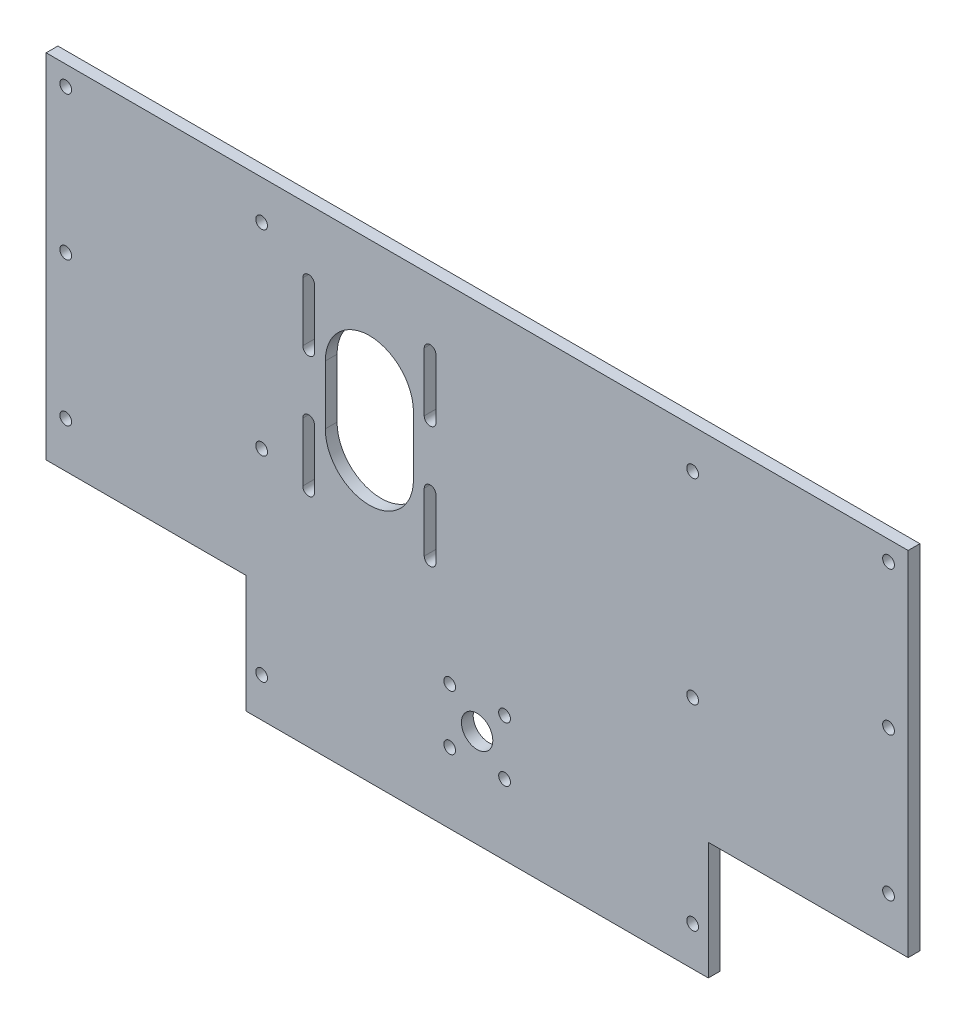
from build123d import *

# Parameters (mm, degrees)
ESQUISSE1_R             = 1.5
BOSS_EXTRU_1_DEPTH      = 3
ESQUISSE3_R             = 4
ESQUISSE3_R_2           = 1.5
ENL_V_MAT_EXTRU_3_DEPTH = 10


with BuildPart() as part:
    # Esquisse1 → Boss.-Extru.1 (new body)
    with BuildSketch(Plane.XY):
        Polygon((110, 65), (60, 65), (-60, 65), (-110, 65), (-110, -25), (-60, -25), (-59, -25), (-59, -55), (-50, -55), (50, -55), (59, -55), (59, -25), (60, -25), (110, -25), align=None)
        with Locations((-55, -45)):
            Circle(ESQUISSE1_R, mode=Mode.SUBTRACT)
        with Locations((-105, -13.333333333)):
            Circle(ESQUISSE1_R, mode=Mode.SUBTRACT)
        with Locations((-55, 5)):
            Circle(ESQUISSE1_R, mode=Mode.SUBTRACT)
        with Locations((55, -45)):
            Circle(ESQUISSE1_R, mode=Mode.SUBTRACT)
        with Locations((105, -13.333333333)):
            Circle(ESQUISSE1_R, mode=Mode.SUBTRACT)
        with Locations((55, 5)):
            Circle(ESQUISSE1_R, mode=Mode.SUBTRACT)
        with Locations((-105, 23.333333333)):
            Circle(ESQUISSE1_R, mode=Mode.SUBTRACT)
        with BuildLine():
            ThreePointArc((-41.5, 2), (-43, 0.5), (-44.5, 2))
            Line((-44.5, 2), (-44.5, 17))
            ThreePointArc((-44.5, 17), (-43, 18.5), (-41.5, 17))
            Line((-41.5, 17), (-41.5, 2))
        make_face(mode=Mode.SUBTRACT)
        with BuildLine():
            Line((-10.5, 17), (-10.5, 2))
            ThreePointArc((-10.5, 2), (-12, 0.5), (-13.5, 2))
            Line((-13.5, 2), (-13.5, 17))
            ThreePointArc((-13.5, 17), (-12, 18.5), (-10.5, 17))
        make_face(mode=Mode.SUBTRACT)
        with BuildLine():
            ThreePointArc((-16.25, 17.5), (-27.5, 6.25), (-38.75, 17.5))
            Line((-38.75, 17.5), (-38.75, 32.5))
            ThreePointArc((-38.75, 32.5), (-27.5, 43.75), (-16.25, 32.5))
            Line((-16.25, 32.5), (-16.25, 17.5))
        make_face(mode=Mode.SUBTRACT)
        with Locations((-105, 60)):
            Circle(ESQUISSE1_R, mode=Mode.SUBTRACT)
        with Locations((-55, 55)):
            Circle(ESQUISSE1_R, mode=Mode.SUBTRACT)
        with BuildLine():
            ThreePointArc((-41.5, 33), (-43, 31.5), (-44.5, 33))
            Line((-44.5, 33), (-44.5, 48))
            ThreePointArc((-44.5, 48), (-43, 49.5), (-41.5, 48))
            Line((-41.5, 48), (-41.5, 33))
        make_face(mode=Mode.SUBTRACT)
        with BuildLine():
            Line((-10.5, 48), (-10.5, 33))
            ThreePointArc((-10.5, 33), (-12, 31.5), (-13.5, 33))
            Line((-13.5, 33), (-13.5, 48))
            ThreePointArc((-13.5, 48), (-12, 49.5), (-10.5, 48))
        make_face(mode=Mode.SUBTRACT)
        with Locations((105, 23.333333333)):
            Circle(ESQUISSE1_R, mode=Mode.SUBTRACT)
        with Locations((55, 55)):
            Circle(ESQUISSE1_R, mode=Mode.SUBTRACT)
        with Locations((105, 60)):
            Circle(ESQUISSE1_R, mode=Mode.SUBTRACT)
    extrude(amount=BOSS_EXTRU_1_DEPTH)

    # Esquisse3 → Enlèv. mat.-Extru.3 (cut)
    with BuildSketch(Plane.XY.offset(3)):
        with Locations((0, -30)):
            Circle(ESQUISSE3_R)
        with Locations((-7, -23)):
            Circle(ESQUISSE3_R_2)
        with Locations((7, -23)):
            Circle(ESQUISSE3_R_2)
        with Locations((7, -37)):
            Circle(ESQUISSE3_R_2)
        with Locations((-7, -37)):
            Circle(ESQUISSE3_R_2)
    extrude(amount=-ENL_V_MAT_EXTRU_3_DEPTH, mode=Mode.SUBTRACT)


solid = part.part
